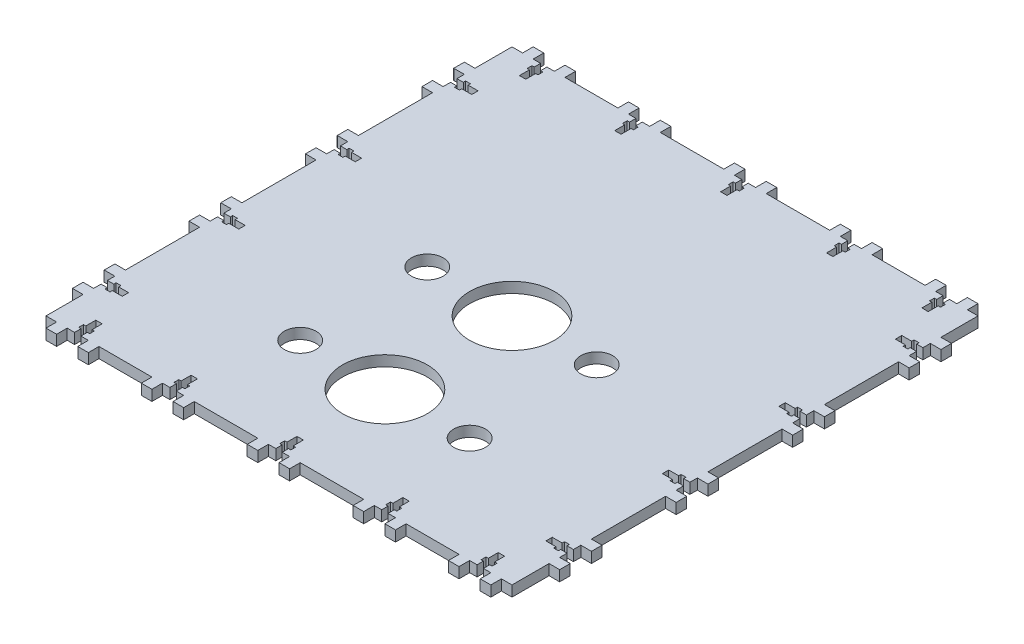
from build123d import *

# Parameters (mm, degrees)
SKETCH1_R           = 7.5
SKETCH1_R_2         = 20
BOSS_EXTRUDE1_DEPTH = 5


with BuildPart() as part:
    # Sketch1 → Boss-Extrude1 (new body)
    with BuildSketch(Plane(origin=(0, 0, 0), x_dir=(1, 0, 0), z_dir=(0, 1, 0))):
        Polygon((-110, -92.5), (-110, -110), (-105, -110), (-105, -115), (-100, -115), (-100, -110), (-96.5, -110), (-96.5, -107), (-97.6, -107), (-97.6, -104.7), (-96.5, -104.7), (-96.5, -100), (-93.5, -100), (-93.5, -104.7), (-92.4, -104.7), (-92.4, -107), (-93.5, -107), (-93.5, -110), (-90, -110), (-90, -115), (-85, -115), (-85, -110), (-60, -110), (-60, -115), (-55, -115), (-55, -110), (-51.5, -110), (-51.5, -107), (-52.6, -107), (-52.6, -104.7), (-51.5, -104.7), (-51.5, -100), (-48.5, -100), (-48.5, -104.7), (-47.4, -104.7), (-47.4, -107), (-48.5, -107), (-48.5, -110), (-45, -110), (-45, -115), (-40, -115), (-40, -110), (-10, -110), (-10, -115), (-5, -115), (-5, -110), (-1.5, -110), (-1.5, -107), (-2.6, -107), (-2.6, -104.7), (-1.5, -104.7), (-1.5, -100), (1.5, -100), (1.5, -104.7), (2.6, -104.7), (2.6, -107), (1.5, -107), (1.5, -110), (5, -110), (5, -115), (10, -115), (10, -110), (40, -110), (40, -115), (45, -115), (45, -110), (48.5, -110), (48.5, -107), (47.4, -107), (47.4, -104.7), (48.5, -104.7), (48.5, -100), (51.5, -100), (51.5, -104.7), (52.6, -104.7), (52.6, -107), (51.5, -107), (51.5, -110), (55, -110), (55, -115), (60, -115), (60, -110), (85, -110), (85, -115), (90, -115), (90, -110), (93.5, -110), (93.5, -107), (92.4, -107), (92.4, -104.7), (93.5, -104.7), (93.5, -100), (96.5, -100), (96.5, -104.7), (97.6, -104.7), (97.6, -107), (96.5, -107), (96.5, -110), (100, -110), (100, -115), (105, -115), (105, -110), (110, -110), (110, -92.5), (115, -92.5), (115, -87.5), (110, -87.5), (110, -84), (107, -84), (107, -85.1), (104.7, -85.1), (104.7, -84), (100, -84), (100, -81), (104.7, -81), (104.7, -79.9), (107, -79.9), (107, -81), (110, -81), (110, -77.5), (115, -77.5), (115, -72.5), (110, -72.5), (110, -37.5), (115, -37.5), (115, -32.5), (110, -32.5), (110, -29), (107, -29), (107, -30.1), (104.7, -30.1), (104.7, -29), (100, -29), (100, -26), (104.7, -26), (104.7, -24.9), (107, -24.9), (107, -26), (110, -26), (110, -22.5), (115, -22.5), (115, -17.5), (110, -17.5), (110, 17.5), (115, 17.5), (115, 22.5), (110, 22.5), (110, 26), (107, 26), (107, 24.9), (104.7, 24.9), (104.7, 26), (100, 26), (100, 29), (104.7, 29), (104.7, 30.1), (107, 30.1), (107, 29), (110, 29), (110, 32.5), (115, 32.5), (115, 37.5), (110, 37.5), (110, 72.5), (115, 72.5), (115, 77.5), (110, 77.5), (110, 81), (107, 81), (107, 79.9), (104.7, 79.9), (104.7, 81), (100, 81), (100, 84), (104.7, 84), (104.7, 85.1), (107, 85.1), (107, 84), (110, 84), (110, 87.5), (115, 87.5), (115, 92.5), (110, 92.5), (110, 110), (105, 110), (105, 115), (100, 115), (100, 110), (96.5, 110), (96.5, 107), (97.6, 107), (97.6, 104.7), (96.5, 104.7), (96.5, 100), (93.5, 100), (93.5, 104.7), (92.4, 104.7), (92.4, 107), (93.5, 107), (93.5, 110), (90, 110), (90, 115), (85, 115), (85, 110), (60, 110), (60, 115), (55, 115), (55, 110), (51.5, 110), (51.5, 107), (52.6, 107), (52.6, 104.7), (51.5, 104.7), (51.5, 100), (48.5, 100), (48.5, 104.7), (47.4, 104.7), (47.4, 107), (48.5, 107), (48.5, 110), (45, 110), (45, 115), (40, 115), (40, 110), (10, 110), (10, 115), (5, 115), (5, 110), (1.5, 110), (1.5, 107), (2.6, 107), (2.6, 104.7), (1.5, 104.7), (1.5, 100), (-1.5, 100), (-1.5, 104.7), (-2.6, 104.7), (-2.6, 107), (-1.5, 107), (-1.5, 110), (-5, 110), (-5, 115), (-10, 115), (-10, 110), (-40, 110), (-40, 115), (-45, 115), (-45, 110), (-48.5, 110), (-48.5, 107), (-47.4, 107), (-47.4, 104.7), (-48.5, 104.7), (-48.5, 100), (-51.5, 100), (-51.5, 104.7), (-52.6, 104.7), (-52.6, 107), (-51.5, 107), (-51.5, 110), (-55, 110), (-55, 115), (-60, 115), (-60, 110), (-85, 110), (-85, 115), (-90, 115), (-90, 110), (-93.5, 110), (-93.5, 107), (-92.4, 107), (-92.4, 104.7), (-93.5, 104.7), (-93.5, 100), (-96.5, 100), (-96.5, 104.7), (-97.6, 104.7), (-97.6, 107), (-96.5, 107), (-96.5, 110), (-100, 110), (-100, 115), (-105, 115), (-105, 110), (-110, 110), (-110, 92.5), (-115, 92.5), (-115, 87.5), (-110, 87.5), (-110, 84), (-107, 84), (-107, 85.1), (-104.7, 85.1), (-104.7, 84), (-100, 84), (-100, 81), (-104.7, 81), (-104.7, 79.9), (-107, 79.9), (-107, 81), (-110, 81), (-110, 77.5), (-115, 77.5), (-115, 72.5), (-110, 72.5), (-110, 37.5), (-115, 37.5), (-115, 32.5), (-110, 32.5), (-110, 29), (-107, 29), (-107, 30.1), (-104.7, 30.1), (-104.7, 29), (-100, 29), (-100, 26), (-104.7, 26), (-104.7, 24.9), (-107, 24.9), (-107, 26), (-110, 26), (-110, 22.5), (-115, 22.5), (-115, 17.5), (-110, 17.5), (-110, -17.5), (-115, -17.5), (-115, -22.5), (-110, -22.5), (-110, -26), (-107, -26), (-107, -24.9), (-104.7, -24.9), (-104.7, -26), (-100, -26), (-100, -29), (-104.7, -29), (-104.7, -30.1), (-107, -30.1), (-107, -29), (-110, -29), (-110, -32.5), (-115, -32.5), (-115, -37.5), (-110, -37.5), (-110, -72.5), (-115, -72.5), (-115, -77.5), (-110, -77.5), (-110, -81), (-107, -81), (-107, -79.9), (-104.7, -79.9), (-104.7, -81), (-100, -81), (-100, -84), (-104.7, -84), (-104.7, -85.1), (-107, -85.1), (-107, -84), (-110, -84), (-110, -87.5), (-115, -87.5), (-115, -92.5), align=None)
        with Locations((-40, -60)):
            Circle(SKETCH1_R, mode=Mode.SUBTRACT)
        with Locations((-40, 0)):
            Circle(SKETCH1_R, mode=Mode.SUBTRACT)
        with Locations((0, -60)):
            Circle(SKETCH1_R_2, mode=Mode.SUBTRACT)
        with Locations((40, -60)):
            Circle(SKETCH1_R, mode=Mode.SUBTRACT)
        Circle(SKETCH1_R_2, mode=Mode.SUBTRACT)
        with Locations((40, 0)):
            Circle(SKETCH1_R, mode=Mode.SUBTRACT)
    extrude(amount=BOSS_EXTRUDE1_DEPTH)


solid = part.part
